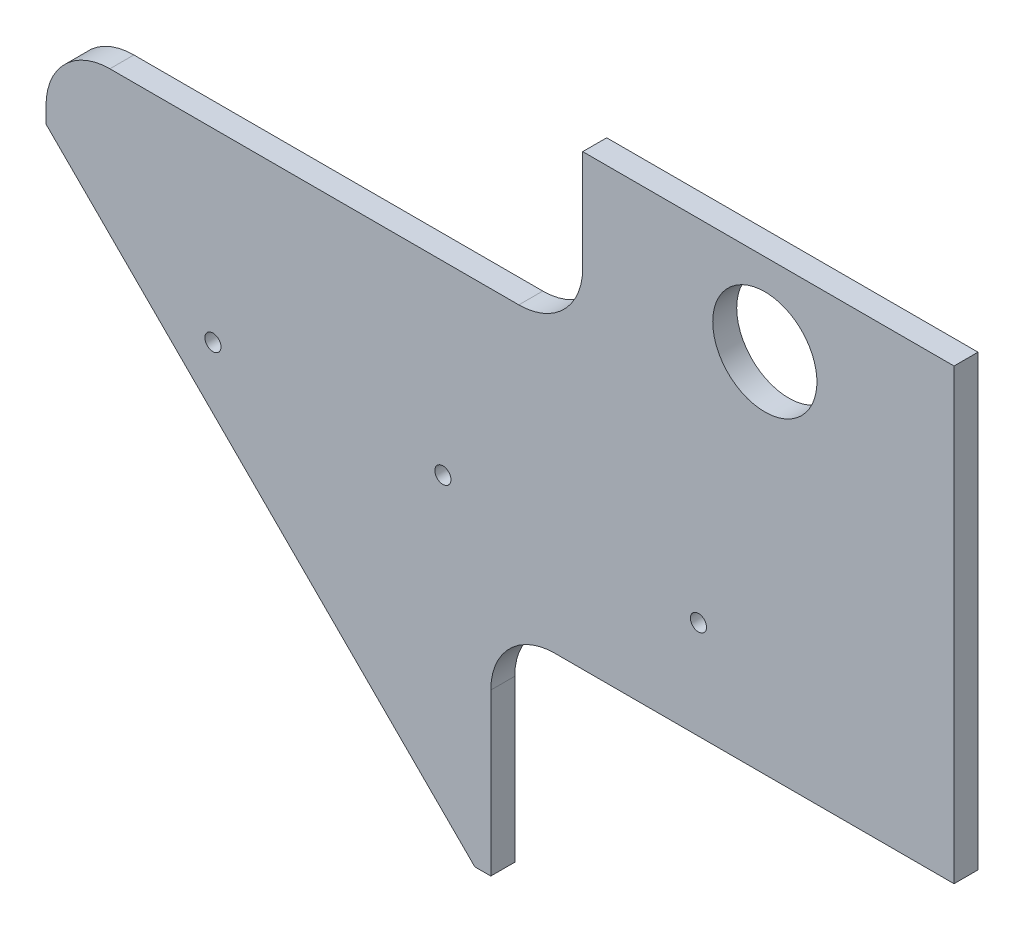
from build123d import *

# Parameters (mm, degrees)
SKETCH1_R                  = 20.701
BOSS_EXTRUDE1_DEPTH        = 9.525
SKETCH2_W                  = 184.15
SKETCH2_H                  = 89.436096718
CUT_EXTRUDE1_DEPTH         = 267.58430025
FILLET1_R                  = 25.4
SKETCH4_W                  = 213.36
SKETCH4_H                  = 65.465352004
CUT_EXTRUDE2_DEPTH         = 267.58430025
FILLET2_R                  = 25.4
F_6_4_6_4_DIAMETER_HOLE2_D = 6.4


with BuildPart() as part:
    # Sketch1 → Boss-Extrude1 (new body)
    with BuildSketch(Plane.XY):
        Polygon((-138.259383474, 48.991487021), (32.210627804, -121.478524257), (222.710627804, -121.478524257), (222.710627804, 146.206839025), (-138.259383474, 146.206839025), align=None)
        with Locations((147.490616526, 113.471475743)):
            Circle(SKETCH1_R, mode=Mode.SUBTRACT)
    extrude(amount=BOSS_EXTRUDE1_DEPTH)

    # Sketch2 → Cut-Extrude1 (cut, through all)
    with BuildSketch(Plane.XY.offset(9.525)):
        with Locations((130.635627804, -76.760475898)):
            Rectangle(SKETCH2_W, SKETCH2_H)
    extrude(amount=-CUT_EXTRUDE1_DEPTH, mode=Mode.SUBTRACT)

    # Fillet1
    fillet1_edges = [part.edges().sort_by_distance(p)[0] for p in [
        (38.560627804, -32.042427539, 4.7625),
    ]]
    fillet(fillet1_edges, radius=FILLET1_R)

    # Sketch4 → Cut-Extrude2 (cut, through all)
    with BuildSketch(Plane.XY.offset(9.525)):
        with Locations((-31.579383474, 113.474163023)):
            Rectangle(SKETCH4_W, SKETCH4_H)
    extrude(amount=-CUT_EXTRUDE2_DEPTH, mode=Mode.SUBTRACT)

    # Fillet2
    fillet2_edges = [part.edges().sort_by_distance(p)[0] for p in [
        (-138.259383474, 80.741487021, 4.7625),
        (75.100616526, 80.741487021, 4.7625),
    ]]
    fillet(fillet2_edges, radius=FILLET2_R)

    # Ø6.4 (6.4) Diameter Hole2 (through all)
    with Locations(Plane(origin=(0, 0, 0), x_dir=(-1, 0, 0), z_dir=(0, 0, -1))):
        with Locations((-121.110627804, 7.042935743), (-19.510627804, 7.042935743), (71.895728372, 7.042935743)):
            Hole(F_6_4_6_4_DIAMETER_HOLE2_D / 2)


solid = part.part
